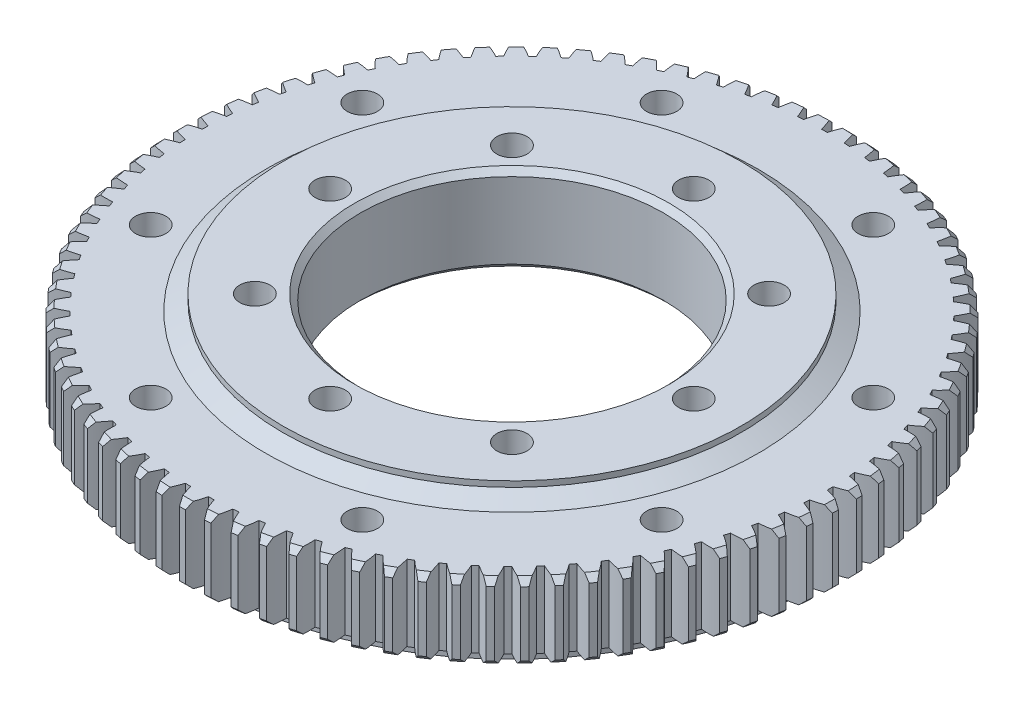
from build123d import *

# Parameters (mm, degrees)
PATTERN_CIRCULAR_2_COUNT = 30
CHAMFER_1_SIZE           = 1.5
CUT_EXTRUDE_1_DEPTH      = 126.167887255
PATTERN_CIRCULAR_3_COUNT = 85
SKETCH_5_R               = 4
CUT_EXTRUDE_2_DEPTH      = 126.961654949
PATTERN_CIRCULAR_4_COUNT = 8
SKETCH_6_R               = 4
CUT_EXTRUDE_3_DEPTH      = 126.165244847
PATTERN_CIRCULAR_5_COUNT = 8
CHAMFER_2_SIZE           = 1.5


with BuildPart() as part:
    # 草图2 → 旋转1 (revolve)
    with BuildSketch(Plane(origin=(0, 0, 0), x_dir=(0, 0, -1), z_dir=(1, 0, 0))):
        with BuildLine():
            Line((-60.5, 13.5), (-60.5, 12))
            Line((-60.5, 12), (-58, 12))
            Line((-58, 12), (-58, 10.5))
            Line((-58, 10.5), (-60.5, 10.5))
            Line((-60.5, 10.5), (-60.5, 4.974937186))
            ThreePointArc((-60.5, 4.974937186), (-55.125602168, 1.113663223), (-58.289899283, -4.698463104))
            Line((-58.289899283, -4.698463104), (-58.289899283, -9.5))
            Line((-58.289899283, -9.5), (-40, -9.5))
            Line((-40, -9.5), (-40, 13.5))
            Line((-40, 13.5), (-60.5, 13.5))
        make_face()
        with BuildLine():
            Line((-61.710100717, 9.5), (-61.710100717, 4.698463104))
            ThreePointArc((-61.710100717, 4.698463104), (-64.874397832, -1.113663223), (-59.5, -4.974937186))
            Line((-59.5, -4.974937186), (-59.5, -10.5))
            Line((-59.5, -10.5), (-62, -10.5))
            Line((-62, -10.5), (-62, -12))
            Line((-62, -12), (-59.5, -12))
            Line((-59.5, -12), (-59.5, -13.5))
            Line((-59.5, -13.5), (-80, -13.5))
            Line((-80, -13.5), (-80, -10.5))
            Line((-80, -10.5), (-87, -10.5))
            Line((-87, -10.5), (-87, 9.5))
            Line((-87, 9.5), (-61.710100717, 9.5))
        make_face()
    revolve(axis=Axis((0, 0, 0), (0, 1, 0)))

    # 倒角1
    chamfer_1_edges = [part.edges().sort_by_distance(p)[0] for p in [
        (0, -10.5, -87),
        (0, 9.5, -87),
    ]]
    chamfer(chamfer_1_edges, length=CHAMFER_1_SIZE)

    # 草图4 → 切除-拉伸1 (cut, through all)
    with BuildSketch(Plane(origin=(0, 9.5, 0), x_dir=(1, 0, 0), z_dir=(0, 1, 0))):
        with BuildLine():
            ThreePointArc((2.420792738, 86.966313953), (0, 87), (-2.420792738, 86.966313953))
            ThreePointArc((-2.420792738, 86.966313953), (-1.488978159, 84.766038442), (-0.741002663, 82.496672145))
            ThreePointArc((-0.741002663, 82.496672145), (0, 82.5), (0.741002663, 82.496672145))
            ThreePointArc((0.741002663, 82.496672145), (1.488978159, 84.766038442), (2.420792738, 86.966313953))
        make_face()
    cut_extrude_1 = extrude(amount=-CUT_EXTRUDE_1_DEPTH, mode=Mode.SUBTRACT)

    # 阵列(圆周)3: 切除-拉伸1 ×85 about axis
    pattern_circular_3_axis = Axis((0, 9.5, 0), (0, 1, 0))
    for i in range(1, PATTERN_CIRCULAR_3_COUNT):
        add(cut_extrude_1.rotate(pattern_circular_3_axis, i * 360 / PATTERN_CIRCULAR_3_COUNT), mode=Mode.SUBTRACT)

    # 草图5 → 切除-拉伸2 (cut, through all)
    with BuildSketch(Plane(origin=(0, 13.5, 0), x_dir=(1, 0, 0), z_dir=(0, 1, 0))):
        with Locations((0, 48)):
            Circle(SKETCH_5_R)
    cut_extrude_2 = extrude(amount=-CUT_EXTRUDE_2_DEPTH, mode=Mode.SUBTRACT)

    # 阵列(圆周)4: 切除-拉伸2 ×8 about axis
    pattern_circular_4_axis = Axis((0, 13.5, 0), (0, -1, 0))
    for i in range(1, PATTERN_CIRCULAR_4_COUNT):
        add(cut_extrude_2.rotate(pattern_circular_4_axis, i * 360 / PATTERN_CIRCULAR_4_COUNT), mode=Mode.SUBTRACT)

    # 草图6 → 切除-拉伸3 (cut, through all)
    with BuildSketch(Plane(origin=(0, 9.5, 0), x_dir=(1, 0, 0), z_dir=(0, 1, 0))):
        with Locations((-27.935890563, 67.443205873)):
            Circle(SKETCH_6_R)
    cut_extrude_3 = extrude(amount=-CUT_EXTRUDE_3_DEPTH, mode=Mode.SUBTRACT)

    # 阵列(圆周)5: 切除-拉伸3 ×8 about axis
    pattern_circular_5_axis = Axis((0, 9.5, 0), (0, -1, 0))
    for i in range(1, PATTERN_CIRCULAR_5_COUNT):
        add(cut_extrude_3.rotate(pattern_circular_5_axis, i * 360 / PATTERN_CIRCULAR_5_COUNT), mode=Mode.SUBTRACT)

    # 倒角2
    chamfer_2_edges = [part.edges().sort_by_distance(p)[0] for p in [
        (0, -9.5, -40),
        (0, 13.5, -40),
    ]]
    chamfer(chamfer_2_edges, length=CHAMFER_2_SIZE)


with BuildPart() as body_2:
    # 草图3 → 旋转2 (revolve)
    with BuildSketch(Plane(origin=(0, 0, 0), x_dir=(0, 0, -1), z_dir=(1, 0, 0))):
        with BuildLine():
            Line((-60, 5), (-60, -5))
            ThreePointArc((-60, -5), (-65, 0), (-60, 5))
        make_face()
    revolve(axis=Axis((0, 5, 60), (0, -1, 0)))


with BuildPart() as pattern_circular_2_1:
    # 阵列(圆周)2: pattern copy
    add(body_2.part.rotate(Axis((0, 9.5, 0), (0, -1, 0)), 1 * 360 / PATTERN_CIRCULAR_2_COUNT))


with BuildPart() as pattern_circular_2_2:
    # 阵列(圆周)2: pattern copy
    add(body_2.part.rotate(Axis((0, 9.5, 0), (0, -1, 0)), 2 * 360 / PATTERN_CIRCULAR_2_COUNT))


with BuildPart() as pattern_circular_2_3:
    # 阵列(圆周)2: pattern copy
    add(body_2.part.rotate(Axis((0, 9.5, 0), (0, -1, 0)), 3 * 360 / PATTERN_CIRCULAR_2_COUNT))


with BuildPart() as pattern_circular_2_4:
    # 阵列(圆周)2: pattern copy
    add(body_2.part.rotate(Axis((0, 9.5, 0), (0, -1, 0)), 4 * 360 / PATTERN_CIRCULAR_2_COUNT))


with BuildPart() as pattern_circular_2_5:
    # 阵列(圆周)2: pattern copy
    add(body_2.part.rotate(Axis((0, 9.5, 0), (0, -1, 0)), 5 * 360 / PATTERN_CIRCULAR_2_COUNT))


with BuildPart() as pattern_circular_2_6:
    # 阵列(圆周)2: pattern copy
    add(body_2.part.rotate(Axis((0, 9.5, 0), (0, -1, 0)), 6 * 360 / PATTERN_CIRCULAR_2_COUNT))


with BuildPart() as pattern_circular_2_7:
    # 阵列(圆周)2: pattern copy
    add(body_2.part.rotate(Axis((0, 9.5, 0), (0, -1, 0)), 7 * 360 / PATTERN_CIRCULAR_2_COUNT))


with BuildPart() as pattern_circular_2_8:
    # 阵列(圆周)2: pattern copy
    add(body_2.part.rotate(Axis((0, 9.5, 0), (0, -1, 0)), 8 * 360 / PATTERN_CIRCULAR_2_COUNT))


with BuildPart() as pattern_circular_2_9:
    # 阵列(圆周)2: pattern copy
    add(body_2.part.rotate(Axis((0, 9.5, 0), (0, -1, 0)), 9 * 360 / PATTERN_CIRCULAR_2_COUNT))


with BuildPart() as pattern_circular_2_10:
    # 阵列(圆周)2: pattern copy
    add(body_2.part.rotate(Axis((0, 9.5, 0), (0, -1, 0)), 10 * 360 / PATTERN_CIRCULAR_2_COUNT))


with BuildPart() as pattern_circular_2_11:
    # 阵列(圆周)2: pattern copy
    add(body_2.part.rotate(Axis((0, 9.5, 0), (0, -1, 0)), 11 * 360 / PATTERN_CIRCULAR_2_COUNT))


with BuildPart() as pattern_circular_2_12:
    # 阵列(圆周)2: pattern copy
    add(body_2.part.rotate(Axis((0, 9.5, 0), (0, -1, 0)), 12 * 360 / PATTERN_CIRCULAR_2_COUNT))


with BuildPart() as pattern_circular_2_13:
    # 阵列(圆周)2: pattern copy
    add(body_2.part.rotate(Axis((0, 9.5, 0), (0, -1, 0)), 13 * 360 / PATTERN_CIRCULAR_2_COUNT))


with BuildPart() as pattern_circular_2_14:
    # 阵列(圆周)2: pattern copy
    add(body_2.part.rotate(Axis((0, 9.5, 0), (0, -1, 0)), 14 * 360 / PATTERN_CIRCULAR_2_COUNT))


with BuildPart() as pattern_circular_2_15:
    # 阵列(圆周)2: pattern copy
    add(body_2.part.rotate(Axis((0, 9.5, 0), (0, -1, 0)), 15 * 360 / PATTERN_CIRCULAR_2_COUNT))


with BuildPart() as pattern_circular_2_16:
    # 阵列(圆周)2: pattern copy
    add(body_2.part.rotate(Axis((0, 9.5, 0), (0, -1, 0)), 16 * 360 / PATTERN_CIRCULAR_2_COUNT))


with BuildPart() as pattern_circular_2_17:
    # 阵列(圆周)2: pattern copy
    add(body_2.part.rotate(Axis((0, 9.5, 0), (0, -1, 0)), 17 * 360 / PATTERN_CIRCULAR_2_COUNT))


with BuildPart() as pattern_circular_2_18:
    # 阵列(圆周)2: pattern copy
    add(body_2.part.rotate(Axis((0, 9.5, 0), (0, -1, 0)), 18 * 360 / PATTERN_CIRCULAR_2_COUNT))


with BuildPart() as pattern_circular_2_19:
    # 阵列(圆周)2: pattern copy
    add(body_2.part.rotate(Axis((0, 9.5, 0), (0, -1, 0)), 19 * 360 / PATTERN_CIRCULAR_2_COUNT))


with BuildPart() as pattern_circular_2_20:
    # 阵列(圆周)2: pattern copy
    add(body_2.part.rotate(Axis((0, 9.5, 0), (0, -1, 0)), 20 * 360 / PATTERN_CIRCULAR_2_COUNT))


with BuildPart() as pattern_circular_2_21:
    # 阵列(圆周)2: pattern copy
    add(body_2.part.rotate(Axis((0, 9.5, 0), (0, -1, 0)), 21 * 360 / PATTERN_CIRCULAR_2_COUNT))


with BuildPart() as pattern_circular_2_22:
    # 阵列(圆周)2: pattern copy
    add(body_2.part.rotate(Axis((0, 9.5, 0), (0, -1, 0)), 22 * 360 / PATTERN_CIRCULAR_2_COUNT))


with BuildPart() as pattern_circular_2_23:
    # 阵列(圆周)2: pattern copy
    add(body_2.part.rotate(Axis((0, 9.5, 0), (0, -1, 0)), 23 * 360 / PATTERN_CIRCULAR_2_COUNT))


with BuildPart() as pattern_circular_2_24:
    # 阵列(圆周)2: pattern copy
    add(body_2.part.rotate(Axis((0, 9.5, 0), (0, -1, 0)), 24 * 360 / PATTERN_CIRCULAR_2_COUNT))


with BuildPart() as pattern_circular_2_25:
    # 阵列(圆周)2: pattern copy
    add(body_2.part.rotate(Axis((0, 9.5, 0), (0, -1, 0)), 25 * 360 / PATTERN_CIRCULAR_2_COUNT))


with BuildPart() as pattern_circular_2_26:
    # 阵列(圆周)2: pattern copy
    add(body_2.part.rotate(Axis((0, 9.5, 0), (0, -1, 0)), 26 * 360 / PATTERN_CIRCULAR_2_COUNT))


with BuildPart() as pattern_circular_2_27:
    # 阵列(圆周)2: pattern copy
    add(body_2.part.rotate(Axis((0, 9.5, 0), (0, -1, 0)), 27 * 360 / PATTERN_CIRCULAR_2_COUNT))


with BuildPart() as pattern_circular_2_28:
    # 阵列(圆周)2: pattern copy
    add(body_2.part.rotate(Axis((0, 9.5, 0), (0, -1, 0)), 28 * 360 / PATTERN_CIRCULAR_2_COUNT))


with BuildPart() as pattern_circular_2_29:
    # 阵列(圆周)2: pattern copy
    add(body_2.part.rotate(Axis((0, 9.5, 0), (0, -1, 0)), 29 * 360 / PATTERN_CIRCULAR_2_COUNT))


with BuildPart() as body_32:
    # 草图7 → 旋转3 (revolve)
    with BuildSketch(Plane.XY):
        Polygon((-60.5, 12), (-58, 12), (-58, 10.5), (-60.5, 10.5), (-65, 9.5), align=None)
        Polygon((-59.5, -10.5), (-62, -10.5), (-62, -12), (-59.5, -12), (-55, -9.5), align=None)
    revolve(axis=Axis((0, 0, 0), (0, 1, 0)))


solid = Compound([part.part, body_2.part, pattern_circular_2_1.part, pattern_circular_2_2.part, pattern_circular_2_3.part, pattern_circular_2_4.part, pattern_circular_2_5.part, pattern_circular_2_6.part, pattern_circular_2_7.part, pattern_circular_2_8.part, pattern_circular_2_9.part, pattern_circular_2_10.part, pattern_circular_2_11.part, pattern_circular_2_12.part, pattern_circular_2_13.part, pattern_circular_2_14.part, pattern_circular_2_15.part, pattern_circular_2_16.part, pattern_circular_2_17.part, pattern_circular_2_18.part, pattern_circular_2_19.part, pattern_circular_2_20.part, pattern_circular_2_21.part, pattern_circular_2_22.part, pattern_circular_2_23.part, pattern_circular_2_24.part, pattern_circular_2_25.part, pattern_circular_2_26.part, pattern_circular_2_27.part, pattern_circular_2_28.part, pattern_circular_2_29.part, body_32.part])
